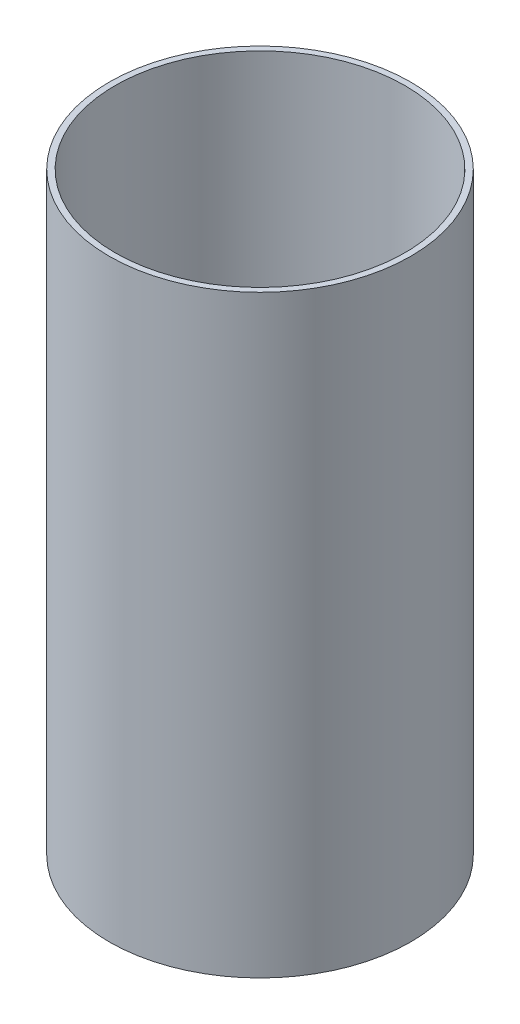
from build123d import *

# Parameters (mm, degrees)
SKETCH1_R           = 25.4
SKETCH1_R_2         = 24.4
BOSS_EXTRUDE1_DEPTH = 100


with BuildPart() as part:
    # Sketch1 → Boss-Extrude1 (new body)
    with BuildSketch(Plane(origin=(0, 0, 0), x_dir=(1, 0, 0), z_dir=(0, 1, 0))):
        Circle(SKETCH1_R)
        Circle(SKETCH1_R_2, mode=Mode.SUBTRACT)
    extrude(amount=BOSS_EXTRUDE1_DEPTH)


solid = part.part
